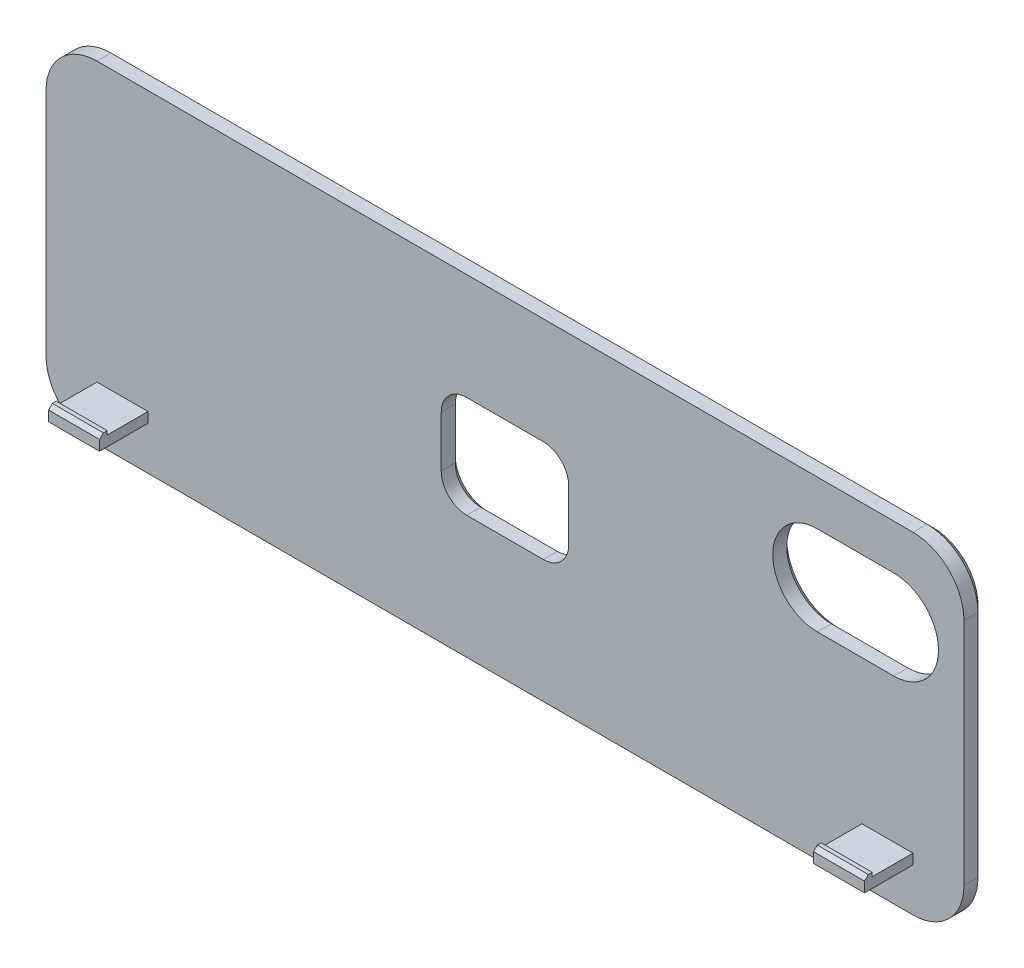
from build123d import *

# Parameters (mm, degrees)
BOSS_EXTRUDE1_START = -80
BOSS_EXTRUDE1_DEPTH = 1.6
CHAMFER1_SIZE       = 0.5
BOSS_EXTRUDE2_START = -81
BOSS_EXTRUDE2_DEPTH = 3
CHAMFER2_SIZE       = 0.5
BOSS_EXTRUDE3_START = -81
BOSS_EXTRUDE3_DEPTH = 3
CHAMFER3_SIZE       = 0.5
BOSS_EXTRUDE4_START = -80.1
SKETCH4_W           = 3
SKETCH4_H           = 0.9
BOSS_EXTRUDE4_DEPTH = 0.9
BOSS_EXTRUDE5_START = -32
BOSS_EXTRUDE5_DEPTH = 4
BOSS_EXTRUDE6_START = 28
BOSS_EXTRUDE6_DEPTH = 4


with BuildPart() as part:
    # Sketch1 → Boss-Extrude1 (new body)
    with BuildSketch(Plane.XY.offset(BOSS_EXTRUDE1_START)):
        with BuildLine():
            Line((-32, 8.6), (32, 8.6))
            ThreePointArc((32, 8.6), (34.828427125, 9.771572875), (36, 12.6))
            Line((36, 12.6), (36, 30.6))
            ThreePointArc((36, 30.6), (34.828427125, 33.428427125), (32, 34.6))
            Line((32, 34.6), (-32, 34.6))
            ThreePointArc((-32, 34.6), (-34.828427125, 33.428427125), (-36, 30.6))
            Line((-36, 30.6), (-36, 12.6))
            ThreePointArc((-36, 12.6), (-34.828427125, 9.771572875), (-32, 8.6))
        make_face()
    extrude(amount=BOSS_EXTRUDE1_DEPTH)

    # Chamfer1
    chamfer1_edges = [part.edges().sort_by_distance(p)[0] for p in [
        (0, 8.6, -80),
        (34.828427125, 9.771572875, -80),
        (-34.828427125, 9.771572875, -80),
        (36, 21.6, -80),
        (-36, 21.6, -80),
        (34.828427125, 33.428427125, -80),
        (-34.828427125, 33.428427125, -80),
        (0, 34.6, -80),
    ]]
    chamfer(chamfer1_edges, length=CHAMFER1_SIZE)


with BuildPart() as body_2:
    # Sketch2 → Boss-Extrude2 (new body)
    with BuildSketch(Plane.XY.offset(BOSS_EXTRUDE2_START)):
        with BuildLine():
            Line((-3, 18.25), (3, 18.25))
            ThreePointArc((3, 18.25), (4.414213562, 18.835786438), (5, 20.25))
            Line((5, 20.25), (5, 24.25))
            ThreePointArc((5, 24.25), (4.414213562, 25.664213562), (3, 26.25))
            Line((3, 26.25), (-3, 26.25))
            ThreePointArc((-3, 26.25), (-4.414213562, 25.664213562), (-5, 24.25))
            Line((-5, 24.25), (-5, 20.25))
            ThreePointArc((-5, 20.25), (-4.414213562, 18.835786438), (-3, 18.25))
        make_face()
    extrude(amount=BOSS_EXTRUDE2_DEPTH)


with BuildPart() as part_1:
    add(part.part)

    # Combine1: cut body 2
    add(body_2.part, mode=Mode.SUBTRACT)

    # Chamfer2
    chamfer2_edges = [part_1.edges().sort_by_distance(p)[0] for p in [
        (0, 18.25, -80),
        (-4.414213562, 18.835786438, -80),
        (4.414213562, 18.835786438, -80),
        (-5, 22.25, -80),
        (5, 22.25, -80),
        (-4.414213562, 25.664213562, -80),
        (4.414213562, 25.664213562, -80),
        (0, 26.25, -80),
    ]]
    chamfer(chamfer2_edges, length=CHAMFER2_SIZE)


with BuildPart() as body_2_2:
    # Sketch3 → Boss-Extrude3 (new body)
    with BuildSketch(Plane.XY.offset(BOSS_EXTRUDE3_START)):
        with BuildLine():
            Line((24.5, 24.08), (30.5, 24.08))
            ThreePointArc((30.5, 24.08), (32.974873734, 25.105126266), (34, 27.58))
            ThreePointArc((34, 27.58), (32.974873734, 30.054873734), (30.5, 31.08))
            Line((30.5, 31.08), (24.5, 31.08))
            ThreePointArc((24.5, 31.08), (22.025126266, 30.054873734), (21, 27.58))
            ThreePointArc((21, 27.58), (22.025126266, 25.105126266), (24.5, 24.08))
        make_face()
    extrude(amount=BOSS_EXTRUDE3_DEPTH)


with BuildPart() as part_2:
    add(part_1.part)

    # Combine2: cut body 2 2
    add(body_2_2.part, mode=Mode.SUBTRACT)

    # Chamfer3
    chamfer3_edges = [part_2.edges().sort_by_distance(p)[0] for p in [
        (27.5, 31.08, -80),
    ]]
    chamfer(chamfer3_edges, length=CHAMFER3_SIZE)


with BuildPart() as body_2_3:
    # Sketch4 → Boss-Extrude4 (new body)
    with BuildSketch(Plane.XY.offset(BOSS_EXTRUDE4_START)):
        with Locations((0, 8.95)):
            Rectangle(SKETCH4_W, SKETCH4_H)
    extrude(amount=BOSS_EXTRUDE4_DEPTH)


with BuildPart() as part_3:
    add(part_2.part)

    # Combine3: cut body 2 3
    add(body_2_3.part, mode=Mode.SUBTRACT)

    # Sketch5 → Boss-Extrude5 (add)
    with BuildSketch(Plane(origin=(0, 0, 0), x_dir=(0, 0, -1), z_dir=(1, 0, 0)).offset(BOSS_EXTRUDE5_START)):
        Polygon((78.41, 12), (74.6, 12), (74.6, 12.8), (74.9, 13.1), (75.2, 13.1), (75.2, 12.8), (78.41, 12.8), align=None)
    extrude(amount=BOSS_EXTRUDE5_DEPTH)

    # Sketch6 → Boss-Extrude6 (add)
    with BuildSketch(Plane(origin=(0, 0, 0), x_dir=(0, 0, -1), z_dir=(1, 0, 0)).offset(BOSS_EXTRUDE6_START)):
        Polygon((78.41, 12), (74.6, 12), (74.6, 12.8), (74.9, 13.1), (75.2, 13.1), (75.2, 12.8), (78.41, 12.8), align=None)
    extrude(amount=BOSS_EXTRUDE6_DEPTH)


solid = part_3.part
